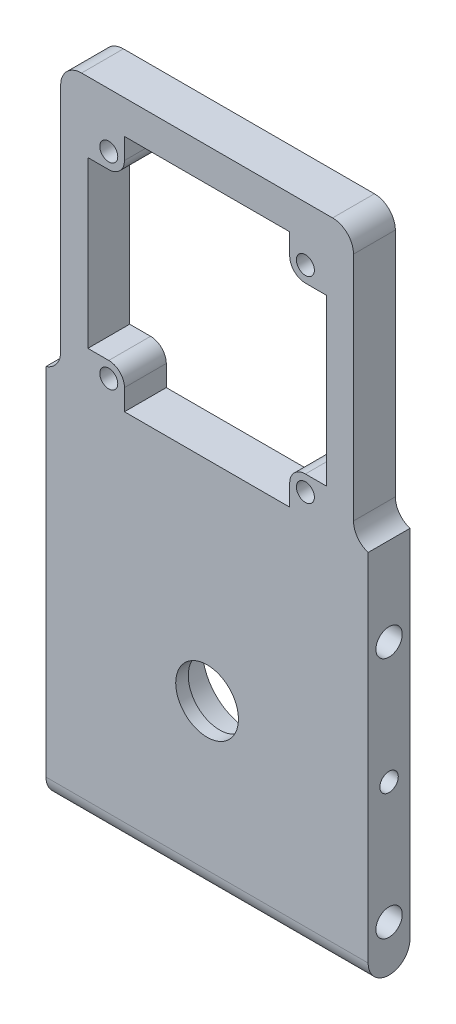
from build123d import *

# Parameters (mm, degrees)
AUFSATZ_LINEAR_AUSTRAGEN1_DEPTH  = 5
SKIZZE2_R                        = 3.15
SCHNITT_LINEAR_AUSTRAGEN1_DEPTH  = 139.488266651
SKIZZE3_R                        = 2.2
SCHNITT_LINEAR_AUSTRAGEN2_DEPTH  = 15
VERRUNDUNG2_R                    = 5
SCHNITT_LINEAR_AUSTRAGEN3_DEPTH  = 122.685044274
F_4_3_4_3_DURCHMESSER_BOHRUNG1_D = 4.3
VERRUNDUNG3_R                    = 5
VERRUNDUNG4_R                    = 5
SKIZZE8_R                        = 11.1
SCHNITT_LINEAR_AUSTRAGEN4_DEPTH  = 7
SKIZZE9_R                        = 7.5
SCHNITT_LINEAR_AUSTRAGEN5_DEPTH  = 10


# Some blends are built 0.0001 mm under size
with BuildPart() as part:
    # Skizze1 → Aufsatz-Linear austragen1 (new, symmetric)
    with BuildSketch(Plane.XY):
        Polygon((38.5, 50), (35, 50), (35, 115), (-35, 115), (-35, 50), (-38.5, 50), (-38.5, -40), (38.5, -40), align=None)
    extrude(amount=AUFSATZ_LINEAR_AUSTRAGEN1_DEPTH, both=True)

    # Skizze2 → Schnitt-Linear austragen1 (cut, through all)
    with BuildSketch(Plane.ZY.offset(38.5)):
        with Locations(Location((0, 29, 0), (0, 0, 270))):
            Circle(SKIZZE2_R)
        with Locations(Location((0, -29, 0), (0, 0, 90))):
            Circle(SKIZZE2_R)
    extrude(amount=-SCHNITT_LINEAR_AUSTRAGEN1_DEPTH, mode=Mode.SUBTRACT)

    # Skizze3 → Schnitt-Linear austragen2 (cut)
    with BuildSketch(Plane.ZY.offset(38.5)):
        with Locations(Location((0, 0, 0), (0, 0, 270))):
            Circle(SKIZZE3_R)
    schnitt_linear_austragen2 = extrude(amount=-SCHNITT_LINEAR_AUSTRAGEN2_DEPTH, mode=Mode.SUBTRACT)

    # Spiegeln1: Schnitt-Linear austragen2 across plane
    add(schnitt_linear_austragen2.mirror(Plane(origin=(0, 0, 0), x_dir=(0, 0, 1), z_dir=(1, 0, 0))), mode=Mode.SUBTRACT)

    # Verrundung2
    verrundung2_edges = [part.edges().sort_by_distance(p)[0] for p in [
        (0, -40, -5),
        (0, -40, 5),
    ]]
    fillet(verrundung2_edges, radius=VERRUNDUNG2_R - 0.0001)  # a hair under: the kernel refuses the full size

    # Skizze5 → Schnitt-Linear austragen3 (cut, through all)
    with BuildSketch(Plane.XY.offset(5)):
        with BuildLine():
            Line((19.75, 102), (19.75, 107))
            Line((19.75, 107), (-19.75, 107))
            Line((-19.75, 107), (-19.75, 102))
            ThreePointArc((-19.75, 102), (-20.848349571, 99.348349571), (-23.5, 98.25))
            Line((-23.5, 98.25), (-28.5, 98.25))
            Line((-28.5, 98.25), (-28.5, 58.75))
            Line((-28.5, 58.75), (-23.5, 58.75))
            ThreePointArc((-23.5, 58.75), (-20.848349571, 57.651650429), (-19.75, 55))
            Line((-19.75, 55), (-19.75, 50))
            Line((-19.75, 50), (19.75, 50))
            Line((19.75, 50), (19.75, 55))
            ThreePointArc((19.75, 55), (20.848349571, 57.651650429), (23.5, 58.75))
            Line((23.5, 58.75), (28.5, 58.75))
            Line((28.5, 58.75), (28.5, 98.25))
            Line((28.5, 98.25), (23.5, 98.25))
            ThreePointArc((23.5, 98.25), (20.848349571, 99.348349571), (19.75, 102))
        make_face()
    extrude(amount=-SCHNITT_LINEAR_AUSTRAGEN3_DEPTH, mode=Mode.SUBTRACT)

    # Ø4.3 (4.3) Durchmesser Bohrung1 (through all)
    with Locations(Plane.XY.offset(5)):
        with Locations((-23.5, 102), (-23.5, 55), (23.5, 55), (23.5, 102)):
            Hole(F_4_3_4_3_DURCHMESSER_BOHRUNG1_D / 2)

    # Verrundung3
    verrundung3_edges = [part.edges().sort_by_distance(p)[0] for p in [
        (-35, 115, 0),
        (35, 115, 0),
    ]]
    fillet(verrundung3_edges, radius=VERRUNDUNG3_R)

    # Verrundung4
    # the kernel refuses this fillet: 5 mm, written as the material it adds along each edge
    with BuildSketch(Plane(origin=(35, 50, -5), x_dir=(0, 1, 0), z_dir=(0, 0, 1))) as verrundung4_piece_1:
        with BuildLine():
            CenterArc((4.769696007, -5), VERRUNDUNG4_R, 90, 72.542396876)
            Line((0, -3.5), (-0.09539392, -3.47))
            ThreePointArc((-0.09539392, -3.47), (-0.1, -1.75), (-0.1, 0))
            Line((-0.1, 0), (0, 0.1))
            Line((0, 0.1), (4.769696007, 0.1))
            Line((4.769696007, 0.1), (4.769696007, 0))
        make_face()
    extrude(amount=10)
    with BuildSketch(Plane(origin=(-35, 50, -5), x_dir=(0, 1, 0), z_dir=(0, 0, 1))) as verrundung4_piece_2:
        with BuildLine():
            CenterArc((4.769696007, 5), VERRUNDUNG4_R, 197.457603124, 72.542396876)
            Line((0, 3.5), (-0.09539392, 3.47))
            ThreePointArc((-0.09539392, 3.47), (-0.1, 1.75), (-0.1, 0))
            Line((-0.1, 0), (0, -0.1))
            Line((0, -0.1), (4.769696007, -0.1))
            Line((4.769696007, -0.1), (4.769696007, 0))
        make_face()
    extrude(amount=10)

    # Skizze8 → Schnitt-Linear austragen4 (cut)
    with BuildSketch(Plane.XY.offset(-5)):
        Circle(SKIZZE8_R)
    extrude(amount=SCHNITT_LINEAR_AUSTRAGEN4_DEPTH, mode=Mode.SUBTRACT)

    # Skizze9 → Schnitt-Linear austragen5 (cut)
    with BuildSketch(Plane(origin=(0, 0, 2), x_dir=(-1, 0, 0), z_dir=(0, 0, -1))):
        Circle(SKIZZE9_R)
    extrude(amount=-SCHNITT_LINEAR_AUSTRAGEN5_DEPTH, mode=Mode.SUBTRACT)


solid = part.part
